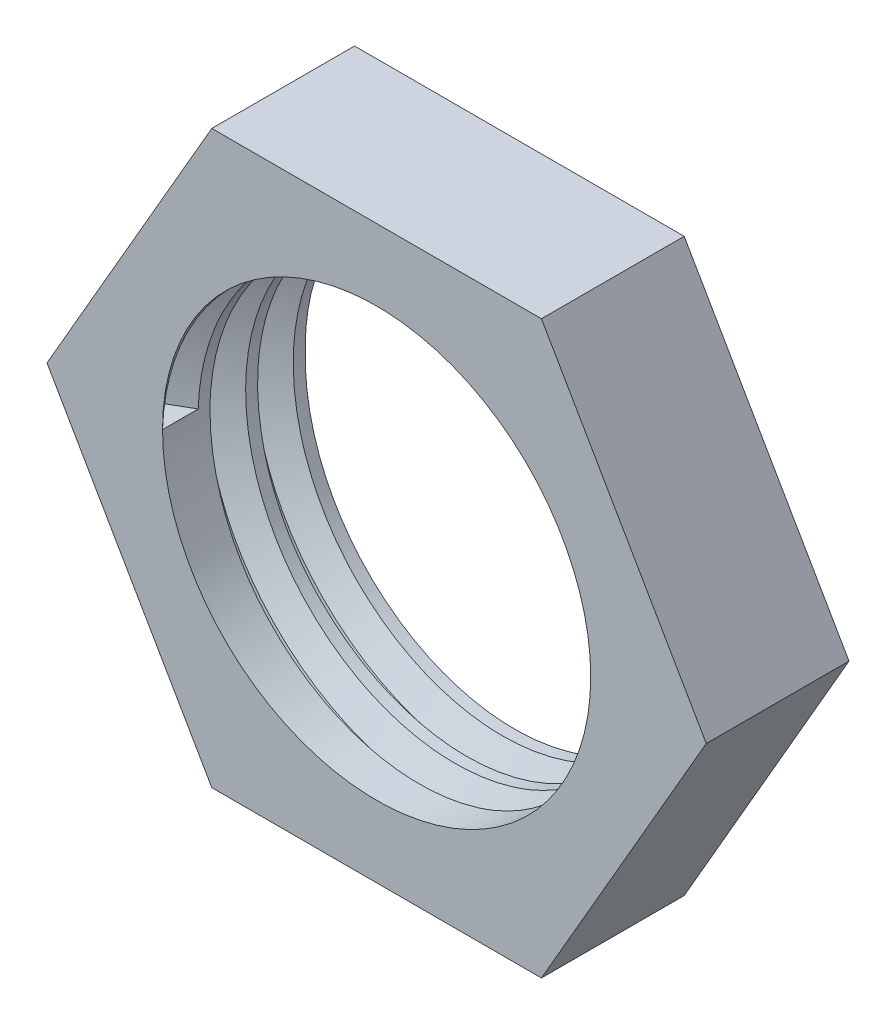
from build123d import *

# Parameters (mm, degrees)
SKETCH_2_R      = 4.5
EXTRUDE_1_DEPTH = 3
THREAD_1_PITCH  = 1


with BuildPart() as part:
    # 草图2 → 凸台-拉伸1 (new body)
    with BuildSketch(Plane.XY):
        Polygon((6.92820323, 0), (3.464101615, 6), (-3.464101615, 6), (-6.92820323, 0), (-3.464101615, -6), (3.464101615, -6), align=None)
        Circle(SKETCH_2_R, mode=Mode.SUBTRACT)
    extrude(amount=EXTRUDE_1_DEPTH)

    # 螺纹线1: the profile of 螺纹线轮廓4 profile screwed along a right-hand helix of 3 turns, 8 arcs to a turn; built about Z, then put on its axis
    thread_1_z = Axis((0, 0, 0), (0, 0, 1))
    thread_1_corners = [(4.4997, 0, -0.000173205), (5.041265875, 0, 0.312499999), (5.041265875, 0, 0.437499999), (4.4997, 0, 0.750173202)]
    with BuildLine(mode=Mode.PRIVATE) as thread_1_profile:
        Line(thread_1_corners[0], thread_1_corners[1])
        Line(thread_1_corners[1], thread_1_corners[2])
        Line(thread_1_corners[2], thread_1_corners[3])
        Line(thread_1_corners[3], thread_1_corners[0])
    thread_1_cap = Face(thread_1_profile.wire())
    thread_1_turn_angles = [0, 22.5, 45, 67.5, 90, 112.5, 135, 157.5, 180, 202.5, 225, 247.5, 270, 292.5, 315, 337.5, 360]
    thread_1_turn_weights = [1, 0.9238795325112867, 1, 0.9238795325112867, 1, 0.9238795325112867, 1, 0.9238795325112867, 1, 0.9238795325112867, 1, 0.9238795325112867, 1, 0.9238795325112867, 1, 0.9238795325112867, 1]
    thread_1_turn_rails = [Edge.make_bspline([Vector(p[0], p[1], 0).rotate(thread_1_z, thread_1_turn_angles[k]) / thread_1_turn_weights[k] + Vector(0, 0, p[2] + THREAD_1_PITCH * thread_1_turn_angles[k] / 360) for k in range(17)], [0, 0, 0, 1, 1, 2, 2, 3, 3, 4, 4, 5, 5, 6, 6, 7, 7, 8, 8, 8], 2, thread_1_turn_weights) for p in thread_1_corners]
    thread_1_turn_sides = [Face.make_surface_from_curves(thread_1_turn_rails[p[0]], thread_1_turn_rails[p[1]]) for p in [(0, 1), (1, 2), (2, 3), (3, 0)]]
    thread_1 = Plane(origin=(0, 0, 3), x_dir=(-1, 0, 0), z_dir=(0, 0, -1)) * Solid(Shell([*[p.moved(Location((0, 0, THREAD_1_PITCH * i))) for i in range(3) for p in thread_1_turn_sides], thread_1_cap, thread_1_cap.rotate(thread_1_z, 1080).moved(Location((0, 0, THREAD_1_PITCH * 1080 / 360)))]))
    add(thread_1, mode=Mode.SUBTRACT)


solid = part.part
